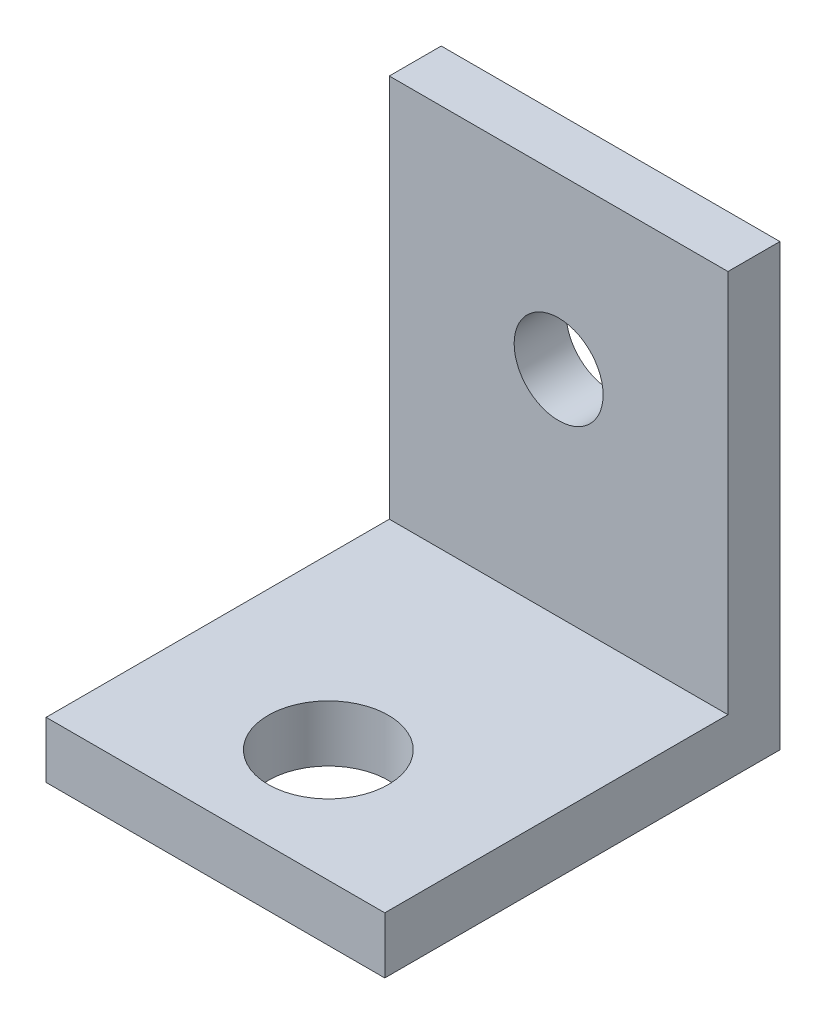
from build123d import *

# Parameters (mm, degrees)
SKETCH1_W                = 19.05
SKETCH1_H                = 22.225
BOSS_EXTRUDE1_DEPTH      = 3.175
SKETCH2_W                = 19.05
SKETCH2_H                = 3.175
BOSS_EXTRUDE2_DEPTH      = 21.59
F_1_4_CLEARANCE_HOLE2_D  = 6.7564
F_8_CLEARANCE_HOLE1_D    = 4.4958
MOVE_START               = -19.304
MOVE_FACE1_OUTLINE_W     = 19.05
MOVE_FACE1_OUTLINE_H     = 21.59
MOVE_FACE1_OUTLINE_R     = 2.2479
MOVE_FACE1_DEPTH         = 0.254
MOVE_START_2             = -22.225
MOVE_FACE1_2_OUTLINE_R   = 2.5019
MOVE_FACE1_2_OUTLINE_R_2 = 2.2479
MOVE_FACE1_2_DEPTH       = 2.921


# Read off the part's stored shape, not the designer's step: Move Face1
with BuildPart() as part:
    # Sketch1 → Boss-Extrude1 (new body)
    with BuildSketch(Plane(origin=(0, 0, 0), x_dir=(1, 0, 0), z_dir=(0, 1, 0))):
        with Locations((9.525, 11.1125)):
            Rectangle(SKETCH1_W, SKETCH1_H)
    extrude(amount=BOSS_EXTRUDE1_DEPTH)

    # Sketch2 → Boss-Extrude2 (add)
    with BuildSketch(Plane(origin=(0, 3.175, 0), x_dir=(1, 0, 0), z_dir=(0, 1, 0))):
        with Locations((9.525, 20.6375)):
            Rectangle(SKETCH2_W, SKETCH2_H)
    extrude(amount=BOSS_EXTRUDE2_DEPTH)

    # 1/4 Clearance Hole2 (through all)
    with Locations(Plane(origin=(9.525, 3.175, -6.35), x_dir=(0, 0, 1), z_dir=(0, 1, 0))):
        with Locations((0, 0)):
            Hole(F_1_4_CLEARANCE_HOLE2_D / 2)

    # #8 Clearance Hole1 (through all)
    with Locations(Plane(origin=(9.525, 15.24, -19.05), x_dir=(1, 0, 0), z_dir=(0, 0, 1))):
        with Locations((0, 0)):
            Hole(F_8_CLEARANCE_HOLE1_D / 2)

    # Move Face1 outline → Move Face1 (cut)
    with BuildSketch(Plane.XY.offset(MOVE_START)):
        with Locations((9.525, 13.97)):
            Rectangle(MOVE_FACE1_OUTLINE_W, MOVE_FACE1_OUTLINE_H)
        with Locations((9.525, 15.24)):
            Circle(MOVE_FACE1_OUTLINE_R, mode=Mode.SUBTRACT)
    extrude(amount=MOVE_FACE1_DEPTH, mode=Mode.SUBTRACT)

    # Move Face1 2 outline → Move Face1 2 (cut)
    with BuildSketch(Plane.XY.offset(MOVE_START_2)):
        with Locations((9.525, 15.24)):
            Circle(MOVE_FACE1_2_OUTLINE_R)
        with Locations((9.525, 15.24)):
            Circle(MOVE_FACE1_2_OUTLINE_R_2, mode=Mode.SUBTRACT)
    extrude(amount=MOVE_FACE1_2_DEPTH, mode=Mode.SUBTRACT)


solid = part.part
